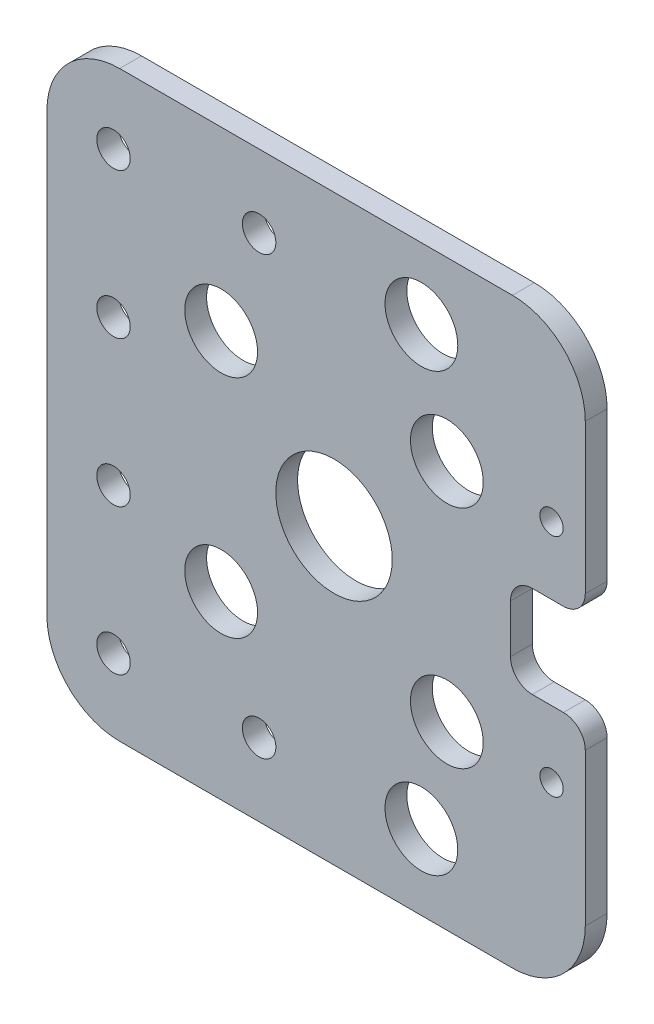
from build123d import *

# Parameters (mm, degrees)
SKETCH1_R           = 2.3
SKETCH1_R_2         = 5
SKETCH1_R_3         = 8
SKETCH1_R_4         = 1.6
BOSS_EXTRUDE1_DEPTH = 3
FILLET1_R           = 3


with BuildPart() as part:
    # Sketch1 → Boss-Extrude1 (new body)
    with BuildSketch(Plane.XY):
        with BuildLine():
            Line((157.960700719, -71.866196008), (170.473892307, -71.866196008))
            ThreePointArc((170.473892307, -71.866196008), (177.544960119, -74.795128196), (180.473892307, -81.866196008))
            Line((180.473892307, -81.866196008), (180.473892307, -102.365535019))
            Line((180.473892307, -102.365535019), (180.473892307, -105.365535019))
            Line((180.473892307, -105.365535019), (170.198907285, -105.365535019))
            Line((170.198907285, -105.365535019), (170.198907285, -117.989469864))
            Line((170.198907285, -117.989469864), (180.473892307, -117.989469864))
            Line((180.473892307, -117.989469864), (180.473892307, -120.989469864))
            Line((180.473892307, -120.989469864), (180.473892307, -141.896756479))
            ThreePointArc((180.473892307, -141.896756479), (177.544960119, -148.967824291), (170.473892307, -151.896756479))
            Line((170.473892307, -151.896756479), (157.960700719, -151.896756479))
            Line((157.960700719, -151.896756479), (116.525823666, -151.896756479))
            ThreePointArc((116.525823666, -151.896756479), (109.454755854, -148.967824291), (106.525823666, -141.896756479))
            Line((106.525823666, -141.896756479), (106.525823666, -81.866196008))
            ThreePointArc((106.525823666, -81.866196008), (109.454755854, -74.795128196), (116.525823666, -71.866196008))
            Line((116.525823666, -71.866196008), (157.960700719, -71.866196008))
        make_face()
        with Locations((115.674612816, -101.866196008)):
            Circle(SKETCH1_R, mode=Mode.SUBTRACT)
        with Locations((115.674612816, -121.866196008)):
            Circle(SKETCH1_R, mode=Mode.SUBTRACT)
        with Locations((135.674612816, -141.866196008)):
            Circle(SKETCH1_R, mode=Mode.SUBTRACT)
        with Locations((135.674612816, -81.866196008)):
            Circle(SKETCH1_R, mode=Mode.SUBTRACT)
        with Locations((115.674612816, -81.866196008)):
            Circle(SKETCH1_R, mode=Mode.SUBTRACT)
        with Locations((115.674612816, -141.866196008)):
            Circle(SKETCH1_R, mode=Mode.SUBTRACT)
        with Locations((161.460700719, -96.114221831)):
            Circle(SKETCH1_R_2, mode=Mode.SUBTRACT)
        with Locations((161.460700719, -127.114221831)):
            Circle(SKETCH1_R_2, mode=Mode.SUBTRACT)
        with Locations((130.460700719, -96.114221831)):
            Circle(SKETCH1_R_2, mode=Mode.SUBTRACT)
        with Locations((145.960700719, -111.591712302)):
            Circle(SKETCH1_R_3, mode=Mode.SUBTRACT)
        with Locations((175.843347401, -96.114221831)):
            Circle(SKETCH1_R_4, mode=Mode.SUBTRACT)
        with Locations((157.960700719, -81.591712302)):
            Circle(SKETCH1_R_2, mode=Mode.SUBTRACT)
        with Locations((157.960700719, -141.591712302)):
            Circle(SKETCH1_R_2, mode=Mode.SUBTRACT)
        with Locations((175.843347401, -127.114221831)):
            Circle(SKETCH1_R_4, mode=Mode.SUBTRACT)
        with Locations((130.460700719, -127.114221831)):
            Circle(SKETCH1_R_2, mode=Mode.SUBTRACT)
    extrude(amount=BOSS_EXTRUDE1_DEPTH)

    # Fillet1
    fillet1_edges = [part.edges().sort_by_distance(p)[0] for p in [
        (170.198907285, -117.989469864, 1.5),
        (180.473892307, -117.989469864, 1.5),
        (170.198907285, -105.365535019, 1.5),
        (180.473892307, -105.365535019, 1.5),
    ]]
    fillet(fillet1_edges, radius=FILLET1_R)


solid = part.part
